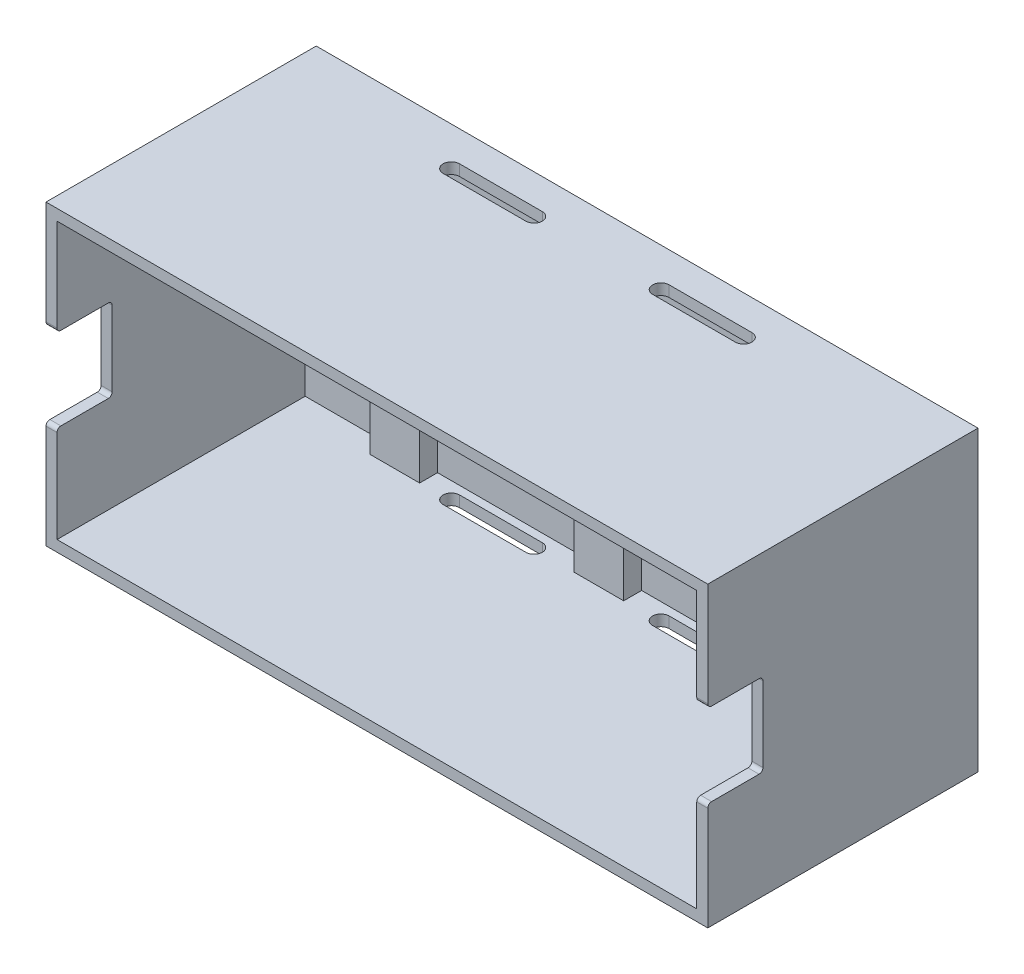
from build123d import *

# Parameters (mm, degrees)
SKETCH1_W               = 120
SKETCH1_H               = 54
BOSS_EXTRUDE1_DEPTH     = 4
SKETCH2_W               = 120
SKETCH2_H               = 54
SKETCH2_W_2             = 116
SKETCH2_H_2             = 50
BOSS_EXTRUDE2_DEPTH     = 45
SKETCH3_W               = 9
SKETCH3_H               = 50
BOSS_EXTRUDE3_DEPTH     = 3.25
SKETCH4_R               = 1.65
CUT_EXTRUDE5_DEPTH      = 14
SKETCH5_W               = 10
SKETCH5_H               = 15
CUT_EXTRUDE7_DEPTH      = 138.876756562
FILLET1_R               = 0.7
FILLET2_R               = 0.7
FILLET3_R               = 0.7
FILLET4_R               = 0.7
FILLET5_R               = 0.7
FILLET6_R               = 0.7
FILLET7_R               = 0.7
FILLET8_R               = 0.7
CUT_EXTRUDE8_DEPTH      = 108.819844306
CUT_EXTRUDE8_DEPTH_BACK = 108.819844306


with BuildPart() as part:
    # Sketch1 → Boss-Extrude1 (new body)
    with BuildSketch(Plane.XY):
        with Locations((-20.747252747, 20)):
            Rectangle(SKETCH1_W, SKETCH1_H)
    extrude(amount=BOSS_EXTRUDE1_DEPTH)

    # Sketch2 → Boss-Extrude2 (add)
    with BuildSketch(Plane.XY.offset(4)):
        with Locations((-20.747252747, 20)):
            Rectangle(SKETCH2_W, SKETCH2_H)
        with Locations((-20.747252747, 20)):
            Rectangle(SKETCH2_W_2, SKETCH2_H_2, mode=Mode.SUBTRACT)
    extrude(amount=BOSS_EXTRUDE2_DEPTH)

    # Sketch3 → Boss-Extrude3 (add)
    with BuildSketch(Plane.XY.offset(4)):
        with Locations((-59.247252747, 20)):
            Rectangle(SKETCH3_W, SKETCH3_H)
        with Locations((-22.247252747, 20)):
            Rectangle(SKETCH3_W, SKETCH3_H)
        with Locations((14.752747253, 20)):
            Rectangle(SKETCH3_W, SKETCH3_H)
    extrude(amount=BOSS_EXTRUDE3_DEPTH)

    # Sketch4 → Cut-Extrude5 (cut)
    with BuildSketch(Plane.XY.offset(4)):
        with Locations((-4.74254548, 39.5)):
            Circle(SKETCH4_R)
        with Locations((-42.205415824, 39.5)):
            Circle(SKETCH4_R)
        with Locations((-72.673636324, 39.5)):
            Circle(SKETCH4_R)
        with Locations((29.282276635, 39.5)):
            Circle(SKETCH4_R)
    extrude(amount=-CUT_EXTRUDE5_DEPTH, mode=Mode.SUBTRACT)

    # Sketch5 → Cut-Extrude7 (cut, through all)
    with BuildSketch(Plane(origin=(39.252747253, 0, 0), x_dir=(0, 0, -1), z_dir=(1, 0, 0))):
        with Locations((-44, 20)):
            Rectangle(SKETCH5_W, SKETCH5_H)
    extrude(amount=-CUT_EXTRUDE7_DEPTH, mode=Mode.SUBTRACT)

    # Fillet1
    fillet1_edges = [part.edges().sort_by_distance(p)[0] for p in [
        (38.252747253, 12.5, 39),
    ]]
    fillet(fillet1_edges, radius=FILLET1_R)

    # Fillet2
    fillet2_edges = [part.edges().sort_by_distance(p)[0] for p in [
        (38.252747253, 27.5, 39),
    ]]
    fillet(fillet2_edges, radius=FILLET2_R)

    # Fillet3
    fillet3_edges = [part.edges().sort_by_distance(p)[0] for p in [
        (-79.747252747, 12.5, 39),
    ]]
    fillet(fillet3_edges, radius=FILLET3_R)

    # Fillet4
    fillet4_edges = [part.edges().sort_by_distance(p)[0] for p in [
        (-79.747252747, 27.5, 39),
    ]]
    fillet(fillet4_edges, radius=FILLET4_R)

    # Fillet5
    fillet5_edges = [part.edges().sort_by_distance(p)[0] for p in [
        (-79.747252747, 12.5, 49),
    ]]
    fillet(fillet5_edges, radius=FILLET5_R)

    # Fillet6
    fillet6_edges = [part.edges().sort_by_distance(p)[0] for p in [
        (-79.747252747, 27.5, 49),
    ]]
    fillet(fillet6_edges, radius=FILLET6_R)

    # Fillet7
    fillet7_edges = [part.edges().sort_by_distance(p)[0] for p in [
        (38.252747253, 12.5, 49),
    ]]
    fillet(fillet7_edges, radius=FILLET7_R)

    # Fillet8
    fillet8_edges = [part.edges().sort_by_distance(p)[0] for p in [
        (38.252747253, 27.5, 49),
    ]]
    fillet(fillet8_edges, radius=FILLET8_R)

    # Sketch6 → Cut-Extrude8 (cut, two sides: drawn at the far end of the back side and taken through both)
    with BuildSketch(Plane(origin=(0, -5, 0), x_dir=(1, 0, 0), z_dir=(0, 1, 0)).offset(-CUT_EXTRUDE8_DEPTH_BACK)):
        with BuildLine():
            Line((-49.247252747, -5.5), (-34.247252747, -5.5))
            ThreePointArc((-34.247252747, -5.5), (-32.747252747, -7), (-34.247252747, -8.5))
            Line((-34.247252747, -8.5), (-49.247252747, -8.5))
            ThreePointArc((-49.247252747, -8.5), (-50.747252747, -7), (-49.247252747, -5.5))
        make_face()
        with BuildLine():
            Line((-11.247252747, -5.5), (3.752747253, -5.5))
            ThreePointArc((3.752747253, -5.5), (5.252747253, -7), (3.752747253, -8.5))
            Line((3.752747253, -8.5), (-11.247252747, -8.5))
            ThreePointArc((-11.247252747, -8.5), (-12.747252747, -7), (-11.247252747, -5.5))
        make_face()
    extrude(amount=CUT_EXTRUDE8_DEPTH + CUT_EXTRUDE8_DEPTH_BACK, mode=Mode.SUBTRACT)


solid = part.part
